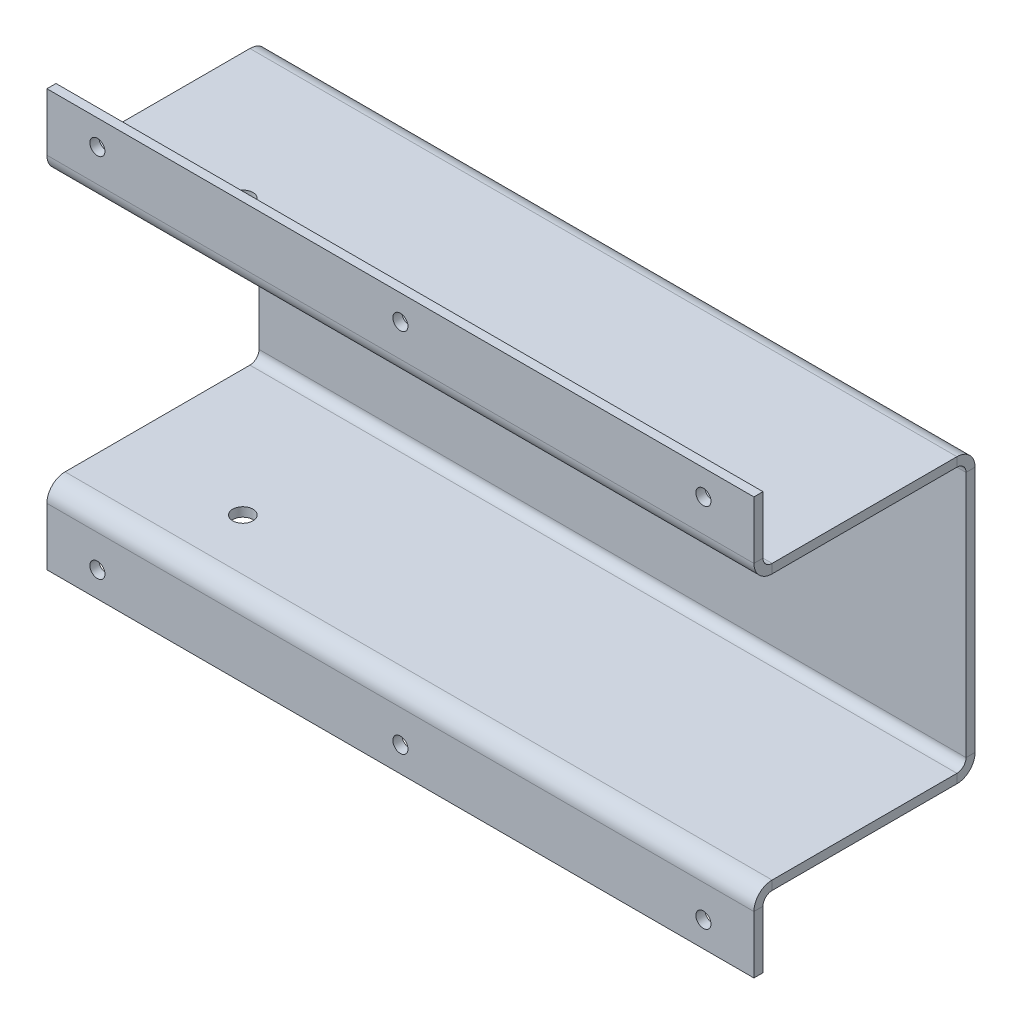
from build123d import *

# Parameters (mm, degrees)
BASE_FLANGE1_DEPTH           = 88.9
F_25_0_1495_DIAMETER_HOLE1_D = 3.7973
F_7_0_201_DIAMETER_HOLE1_D   = 5.1054
F_3_4_0_75_DIAMETER_HOLE1_D  = 19.05


# Sheet-metal steps are written as plain solids
with BuildPart() as part:
    # Sketch1 → Base-Flange1 (new, symmetric)
    with BuildSketch(Plane.YZ):
        with BuildLine():
            Line((-52.3875, 26.67), (-37.9095, 26.67))
            ThreePointArc((-37.9095, 26.67), (-34.676607796, 25.330892204), (-33.3375, 22.098))
            Line((-33.3375, 22.098), (-33.3375, -24.384))
            ThreePointArc((-33.3375, -24.384), (-32.667946102, -26.000446102), (-31.0515, -26.67))
            Line((-31.0515, -26.67), (31.0515, -26.67))
            ThreePointArc((31.0515, -26.67), (32.667946102, -26.000446102), (33.3375, -24.384))
            Line((33.3375, -24.384), (33.3375, 22.098))
            ThreePointArc((33.3375, 22.098), (34.676607796, 25.330892204), (37.9095, 26.67))
            Line((37.9095, 26.67), (52.3875, 26.67))
            Line((52.3875, 26.67), (52.3875, 24.384))
            Line((52.3875, 24.384), (37.9095, 24.384))
            ThreePointArc((37.9095, 24.384), (36.293053898, 23.714446102), (35.6235, 22.098))
            Line((35.6235, 22.098), (35.6235, -24.384))
            ThreePointArc((35.6235, -24.384), (34.284392204, -27.616892204), (31.0515, -28.956))
            Line((31.0515, -28.956), (-31.0515, -28.956))
            ThreePointArc((-31.0515, -28.956), (-34.284392204, -27.616892204), (-35.6235, -24.384))
            Line((-35.6235, -24.384), (-35.6235, 22.098))
            ThreePointArc((-35.6235, 22.098), (-36.293053898, 23.714446102), (-37.9095, 24.384))
            Line((-37.9095, 24.384), (-52.3875, 24.384))
            Line((-52.3875, 24.384), (-52.3875, 26.67))
        make_face()
    extrude(amount=BASE_FLANGE1_DEPTH, both=True)

    # #25 (0.1495) Diameter Hole1 (through all)
    with Locations(Plane.XY.offset(26.67)):
        with Locations((-76.2, 46.0375), (0, 46.0375), (76.2, 46.0375), (76.2, -46.0375), (0, -46.0375), (-76.2, -46.0375)):
            Hole(F_25_0_1495_DIAMETER_HOLE1_D / 2)

    # #7 (0.201) Diameter Hole1 (through all)
    with Locations(Plane.XZ.offset(35.6235)):
        with Locations((-57.15, 9.144)):
            Hole(F_7_0_201_DIAMETER_HOLE1_D / 2)

    # 3/4 (0.75) Diameter Hole1 (through all)
    with Locations(Plane.XY.offset(-26.67)):
        with Locations((-57.15, 0)):
            Hole(F_3_4_0_75_DIAMETER_HOLE1_D / 2)


solid = part.part
